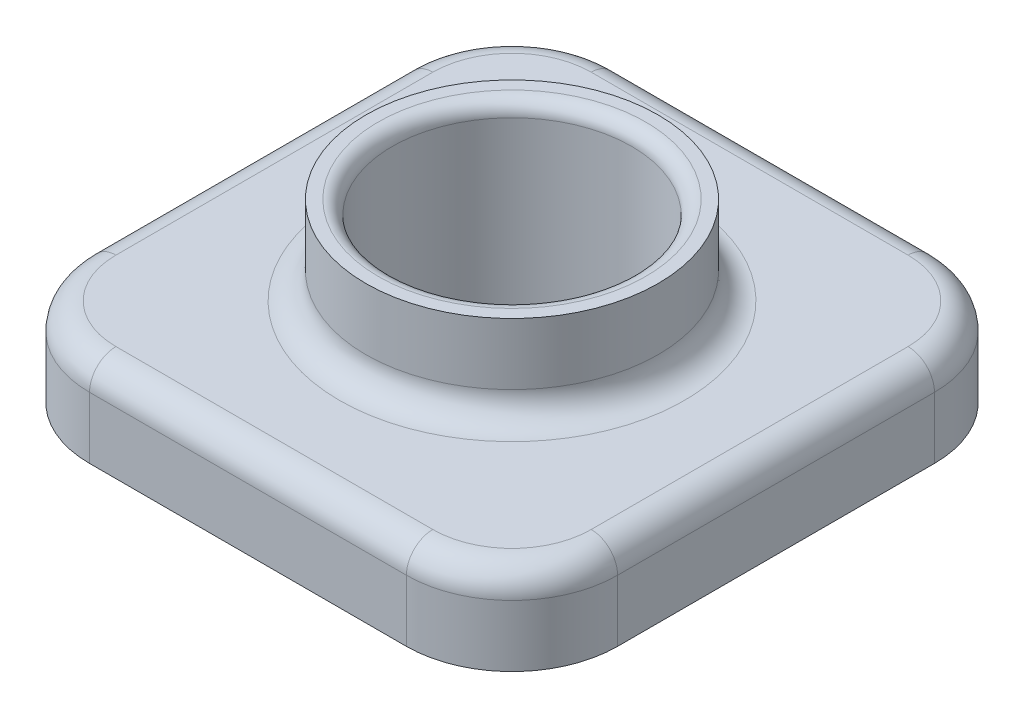
from build123d import *

# Parameters (mm, degrees)
SKETCH1_R           = 8.3
SKETCH1_R_2         = 6.8
BOSS_EXTRUDE1_DEPTH = 5
BOSS_EXTRUDE2_START = 5
SKETCH2_R           = 6.8
BOSS_EXTRUDE2_DEPTH = 5
FILLET1_R           = 0.8
FILLET2_R           = 1.5


with BuildPart() as part:
    # Sketch1 → Boss-Extrude1 (new body)
    with BuildSketch(Plane(origin=(0, 0, 0), x_dir=(1, 0, 0), z_dir=(0, 1, 0))):
        Circle(SKETCH1_R)
        Circle(SKETCH1_R_2, mode=Mode.SUBTRACT)
    extrude(amount=BOSS_EXTRUDE1_DEPTH)

    # Sketch2 → Boss-Extrude2 (add)
    with BuildSketch(Plane.XZ.offset(BOSS_EXTRUDE2_START)):
        with BuildLine():
            Line((-9, -15), (9, -15))
            ThreePointArc((9, -15), (13.242640687, -13.242640687), (15, -9))
            Line((15, -9), (15, 9))
            ThreePointArc((15, 9), (13.242640687, 13.242640687), (9, 15))
            Line((9, 15), (-9, 15))
            ThreePointArc((-9, 15), (-13.242640687, 13.242640687), (-15, 9))
            Line((-15, 9), (-15, -9))
            ThreePointArc((-15, -9), (-13.242640687, -13.242640687), (-9, -15))
        make_face()
        Circle(SKETCH2_R, mode=Mode.SUBTRACT)
    extrude(amount=-BOSS_EXTRUDE2_DEPTH)

    # Fillet1
    fillet1_edges = [part.edges().sort_by_distance(p)[0] for p in [
        (-6.8, 5, 0),
    ]]
    fillet(fillet1_edges, radius=FILLET1_R)

    # Fillet2
    fillet2_edges = [part.edges().sort_by_distance(p)[0] for p in [
        (0, 0, -15),
        (13.242640687, 0, -13.242640687),
        (15, 0, 0),
        (13.242640687, 0, 13.242640687),
        (0, 0, 15),
        (-13.242640687, 0, 13.242640687),
        (-15, 0, 0),
        (-13.242640687, 0, -13.242640687),
        (-8.3, 0, 0),
    ]]
    fillet(fillet2_edges, radius=FILLET2_R)


solid = part.part
